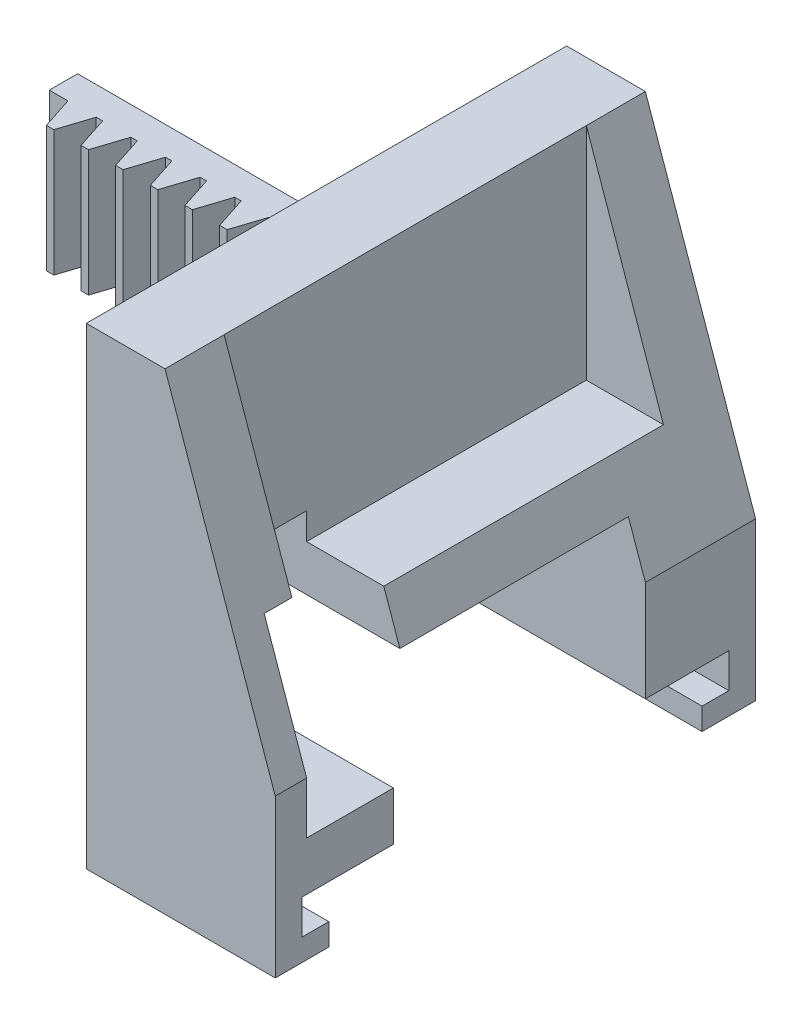
from build123d import *

# Parameters (mm, degrees)
BOSS_EXTRUDE1_DEPTH = 30.5
SKETCH4_W           = 16
SKETCH4_H           = 14
CUT_EXTRUDE2_DEPTH  = 25
CUT_EXTRUDE4_DEPTH  = 11.5
SKETCH8_W           = 7
SKETCH8_H           = 11
CUT_EXTRUDE5_DEPTH  = 45.432533126
CUT_EXTRUDE6_DEPTH  = 45.432533126
SKETCH7_W           = 28
SKETCH7_H           = 1.8
BOSS_EXTRUDE3_DEPTH = 8
BOSS_EXTRUDE4_DEPTH = 8


with BuildPart() as part:
    # Sketch1 → Boss-Extrude1 (new body)
    with BuildSketch(Plane.XY):
        Polygon((0, 0), (0, -30), (12, -30), (12, -20), (5, 0), align=None)
    extrude(amount=-BOSS_EXTRUDE1_DEPTH)

    # Sketch4 → Cut-Extrude2 (cut)
    with BuildSketch(Plane.ZY):
        with Locations((-15.5, -23.917856259)):
            Rectangle(SKETCH4_W, SKETCH4_H)
    extrude(amount=-CUT_EXTRUDE2_DEPTH, mode=Mode.SUBTRACT)

    # Sketch6 → Cut-Extrude4 (cut, symmetric)
    with BuildSketch(Plane.XY.offset(-15.25)):
        Polygon((5, 0), (5, -14), (9.9, -14), align=None)
    extrude(amount=CUT_EXTRUDE4_DEPTH, both=True, mode=Mode.SUBTRACT)

    # Sketch8 → Cut-Extrude5 (cut, through all)
    with BuildSketch(Plane.ZY):
        with Locations((-5.491214764, -17.8)):
            Rectangle(SKETCH8_W, SKETCH8_H)
    extrude(amount=-CUT_EXTRUDE5_DEPTH, mode=Mode.SUBTRACT)

    # Sketch9 → Cut-Extrude6 (cut, through all)
    with BuildSketch(Plane.ZY):
        Polygon((-7.5, -26.4), (-1.7, -26.4), (-1.7, -28.6), (-3.4, -28.6), (-3.4, -30.296685761), (-7.5, -30.296685761), align=None)
        Polygon((-23, -30.296685761), (-23, -26.4), (-28.8, -26.4), (-28.8, -28.6), (-27.1, -28.6), (-27.1, -30.296685761), align=None)
    extrude(amount=-CUT_EXTRUDE6_DEPTH, mode=Mode.SUBTRACT)

    # Sketch7 → Boss-Extrude3 (add)
    with BuildSketch(Plane(origin=(0, -22, 0), x_dir=(1, 0, 0), z_dir=(0, 1, 0))):
        with Locations((-14, 26.55)):
            Rectangle(SKETCH7_W, SKETCH7_H)
    extrude(amount=BOSS_EXTRUDE3_DEPTH)

    # Sketch10 → Boss-Extrude4 (add)
    with BuildSketch(Plane(origin=(0, -14, 0), x_dir=(1, 0, 0), z_dir=(0, 1, 0))):
        Polygon((-0.819680808, 25.65), (-1.479888303, 23.620935831), (-1.953883427, 23.620935831), (-2.614090922, 25.65), align=None)
        Polygon((-4.814090922, 25.65), (-3.019680808, 25.65), (-3.679888303, 23.620935831), (-4.153883427, 23.620935831), align=None)
        Polygon((-7.014090922, 25.65), (-5.219680808, 25.65), (-5.879888303, 23.620935831), (-6.353883427, 23.620935831), align=None)
        Polygon((-9.214090922, 25.65), (-7.419680808, 25.65), (-8.079888303, 23.620935831), (-8.553883427, 23.620935831), align=None)
        Polygon((-11.414090922, 25.65), (-9.619680808, 25.65), (-10.279888303, 23.620935831), (-10.753883427, 23.620935831), align=None)
        Polygon((-13.614090922, 25.65), (-11.819680808, 25.65), (-12.479888303, 23.620935831), (-12.953883427, 23.620935831), align=None)
        Polygon((-15.814090922, 25.65), (-14.019680808, 25.65), (-14.679888303, 23.620935831), (-15.153883427, 23.620935831), align=None)
        Polygon((-18.014090922, 25.65), (-16.219680808, 25.65), (-16.879888303, 23.620935831), (-17.353883427, 23.620935831), align=None)
        Polygon((-20.214090922, 25.65), (-18.419680808, 25.65), (-19.079888303, 23.620935831), (-19.553883427, 23.620935831), align=None)
        Polygon((-22.414090922, 25.65), (-20.619680808, 25.65), (-21.279888303, 23.620935831), (-21.753883427, 23.620935831), align=None)
        Polygon((-24.614090922, 25.65), (-22.819680808, 25.65), (-23.479888303, 23.620935831), (-23.953883427, 23.620935831), align=None)
        Polygon((-26.814090922, 25.65), (-25.019680808, 25.65), (-25.679888303, 23.620935831), (-26.153883427, 23.620935831), align=None)
    extrude(amount=-BOSS_EXTRUDE4_DEPTH)


solid = part.part
